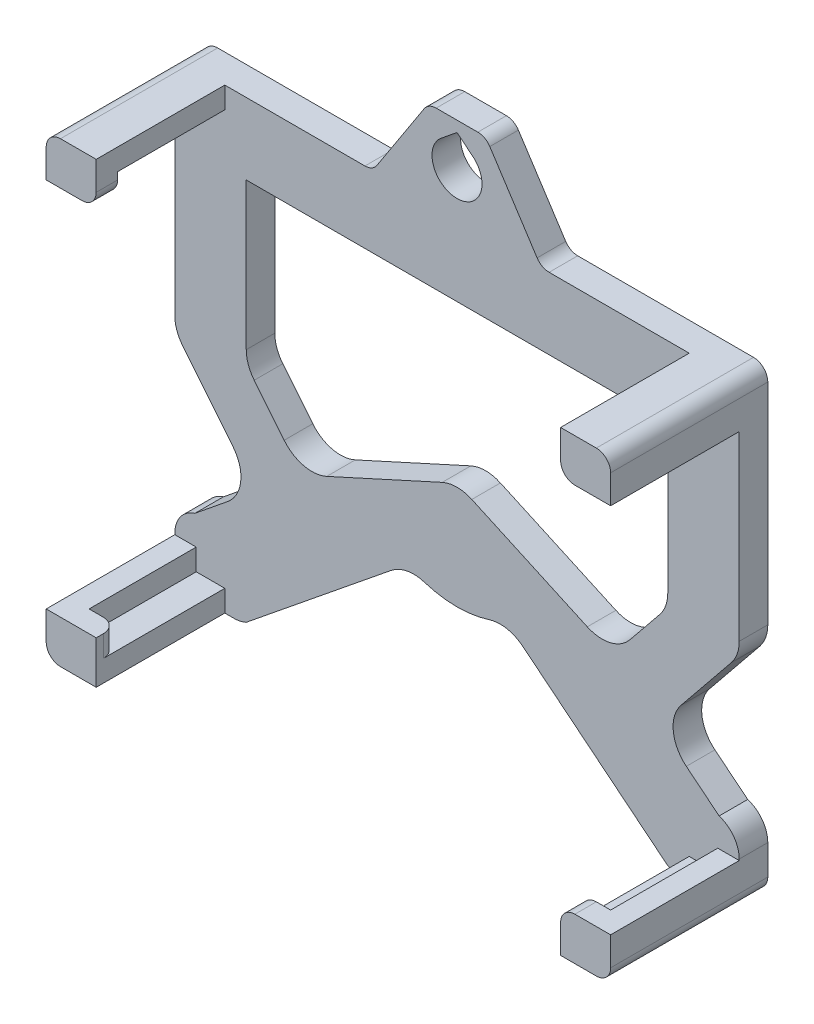
from build123d import *

# Parameters (mm, degrees)
SKETCH1_W           = 79
SKETCH1_H           = 64
BOSS_EXTRUDE1_DEPTH = 4
BOSS_EXTRUDE2_DEPTH = 15
SKETCH3_W           = 7
SKETCH3_H           = 6
BOSS_EXTRUDE3_DEPTH = 3
CUT_EXTRUDE1_DEPTH  = 4
BOSS_EXTRUDE4_DEPTH = 4
FILLET1_R           = 2
FILLET2_R           = 5
FILLET3_R           = 4


with BuildPart() as part:
    # Sketch1 → Boss-Extrude1 (new body)
    with BuildSketch(Plane.XY):
        with Locations((36.5, 29)):
            Rectangle(SKETCH1_W, SKETCH1_H)
    extrude(amount=BOSS_EXTRUDE1_DEPTH)

    # Sketch2 → Boss-Extrude2 (add)
    with BuildSketch(Plane.XY.offset(4)):
        Polygon((76, -3), (76, 3), (73, 3), (73, 0), (69, 0), (69, -3), align=None)
        Polygon((0, 3), (-3, 3), (-3, -3), (4, -3), (4, 0), (0, 0), align=None)
        Polygon((0, 58), (4, 58), (4, 61), (-3, 61), (-3, 55), (0, 55), align=None)
        Polygon((76, 61), (69, 61), (69, 58), (73, 58), (73, 55), (76, 55), align=None)
    extrude(amount=BOSS_EXTRUDE2_DEPTH)

    # Sketch3 → Boss-Extrude3 (add)
    with BuildSketch(Plane.XY.offset(19)):
        with Locations((0.5, 58)):
            Rectangle(SKETCH3_W, SKETCH3_H)
        with Locations((0.5, 0)):
            Rectangle(SKETCH3_W, SKETCH3_H)
        with Locations((72.5, 0)):
            Rectangle(SKETCH3_W, SKETCH3_H)
        with Locations((72.5, 58)):
            Rectangle(SKETCH3_W, SKETCH3_H)
    extrude(amount=BOSS_EXTRUDE3_DEPTH)

    # Sketch4 → Cut-Extrude1 (cut)
    with BuildSketch(Plane(origin=(0, 0, 0), x_dir=(-1, 0, 0), z_dir=(0, 0, -1))):
        Polygon((3, 27.803812192), (-8.289774189, 13.867997178), (0.187909827, 7), (3, 7), align=None)
        Polygon((-73.187909827, 7), (-64.710225811, 13.867997178), (-76, 27.803812192), (-76, 7), align=None)
        Polygon((-7, 51), (-66, 51), (-66, 28.65625), (-58.25574912, 19.09694032), (-36.5, 29), (-14.74425088, 19.09694032), (-7, 28.65625), align=None)
        with BuildLine():
            Line((-66, -2.620585177), (-66, -3))
            Line((-66, -3), (-7, -3))
            Line((-7, -3), (-7, -2.620585177))
            Line((-7, -2.620585177), (-29.594686034, 15.683970598))
            ThreePointArc((-29.594686034, 15.683970598), (-36.5, 14), (-43.405313966, 15.683970598))
            Line((-43.405313966, 15.683970598), (-66, -2.620585177))
        make_face()
    extrude(amount=-CUT_EXTRUDE1_DEPTH, mode=Mode.SUBTRACT)

    # Sketch5 → Boss-Extrude4 (add)
    with BuildSketch(Plane(origin=(0, 0, 0), x_dir=(-1, 0, 0), z_dir=(0, 0, -1))):
        Polygon((-24.697125845, 61), (-32.5, 73), (-40.5, 73), (-48.302874155, 61), align=None)
        with BuildLine():
            Line((-38.826625292, 69.61473034), (-36.5, 71.5))
            Line((-36.5, 71.5), (-34.173374708, 69.61473034))
            ThreePointArc((-34.173374708, 69.61473034), (-36.5, 63.5), (-38.826625292, 69.61473034))
        make_face(mode=Mode.SUBTRACT)
    extrude(amount=-BOSS_EXTRUDE4_DEPTH)

    # Fillet1
    fillet1_edges = [part.edges().sort_by_distance(p)[0] for p in [
        (4, 1.5, 19),
        (69, 3, 20.5),
        (69, 55, 20.5),
        (32.5, 73, 2),
        (24.697125845, 61, 2),
        (48.302874155, 61, 2),
        (40.5, 73, 2),
        (76, 61, 11),
        (76, -3, 11),
        (-3, -3, 11),
        (-3, 61, 11),
        (4, 55, 20.5),
    ]]
    fillet(fillet1_edges, radius=FILLET1_R)

    # Fillet2
    fillet2_edges = [part.edges().sort_by_distance(p)[0] for p in [
        (76, 27.803812192, 2),
        (64.710225811, 13.867997178, 2),
        (-3, 27.803812192, 2),
        (8.289774189, 13.867997178, 2),
        (7, 28.65625, 2),
        (14.74425088, 19.09694032, 2),
        (36.5, 29, 2),
        (58.25574912, 19.09694032, 2),
        (66, 28.65625, 2),
        (43.405313966, 15.683970598, 2),
        (29.594686034, 15.683970598, 2),
    ]]
    fillet(fillet2_edges, radius=FILLET2_R)

    # Fillet3
    # the kernel refuses this fillet: 4 mm, written as the material it takes off along each edge
    with BuildSketch(Plane(origin=(76, 7, -9.548844905), x_dir=(-1, 0, 0), z_dir=(0, 0, 1))) as fillet3_piece_1:
        with BuildLine():
            CenterArc((4, 3.819537962), FILLET3_R, 180, 72.723847708)
            Line((0, 3.819537962), (-0.08, 3.819537962))
            Line((-0.08, 3.819537962), (-0.08, 0))
            Line((-0.08, 0), (0, -0.08))
            ThreePointArc((0, -0.08), (1.406045086, -0.08), (2.788331976, -0.076390759))
            Line((2.788331976, -0.076390759), (2.812090173, 0))
        make_face()
    extrude(amount=23.097689809, mode=Mode.SUBTRACT)
    with BuildSketch(Plane(origin=(-3, 7, -9.548844905), x_dir=(1, 0, 0), z_dir=(0, 0, 1))) as fillet3_piece_2:
        with BuildLine():
            CenterArc((4, -3.819537962), FILLET3_R, 107.276152292, 72.723847708)
            Line((0, -3.819537962), (-0.08, -3.819537962))
            Line((-0.08, -3.819537962), (-0.08, 0))
            Line((-0.08, 0), (0, 0.08))
            ThreePointArc((0, 0.08), (1.406045086, 0.08), (2.788331976, 0.076390759))
            Line((2.788331976, 0.076390759), (2.812090173, 0))
        make_face()
    extrude(amount=23.097689809, mode=Mode.SUBTRACT)
    with BuildSketch(Plane(origin=(7, -3, -4.251002073), x_dir=(0, 1, 0), z_dir=(0, 0, 1))) as fillet3_piece_3:
        with BuildLine():
            CenterArc((4, 1.700400829), FILLET3_R, 180, 25.15700637)
            Line((0, 1.700400829), (-0.08, 1.700400829))
            Line((-0.08, 1.700400829), (-0.08, 0))
            Line((-0.08, 0), (0, -0.08))
            ThreePointArc((0, -0.08), (0.189707412, -0.08), (0.30700312, -0.034008017))
            Line((0.30700312, -0.034008017), (0.379414823, 0))
        make_face()
    extrude(amount=12.502004146, mode=Mode.SUBTRACT)
    with BuildSketch(Plane(origin=(66, -3, -4.251002073), x_dir=(1, 0, 0), z_dir=(0, 0, 1))) as fillet3_piece_4:
        with BuildLine():
            CenterArc((1.700400829, 4), FILLET3_R, 244.84299363, 25.15700637)
            Line((0, 0.379414823), (-0.034008017, 0.30700312))
            ThreePointArc((-0.034008017, 0.30700312), (-0.08, 0.189707412), (-0.08, 0))
            Line((-0.08, 0), (0, -0.08))
            Line((0, -0.08), (1.700400829, -0.08))
            Line((1.700400829, -0.08), (1.700400829, 0))
        make_face()
    extrude(amount=12.502004146, mode=Mode.SUBTRACT)


solid = part.part
